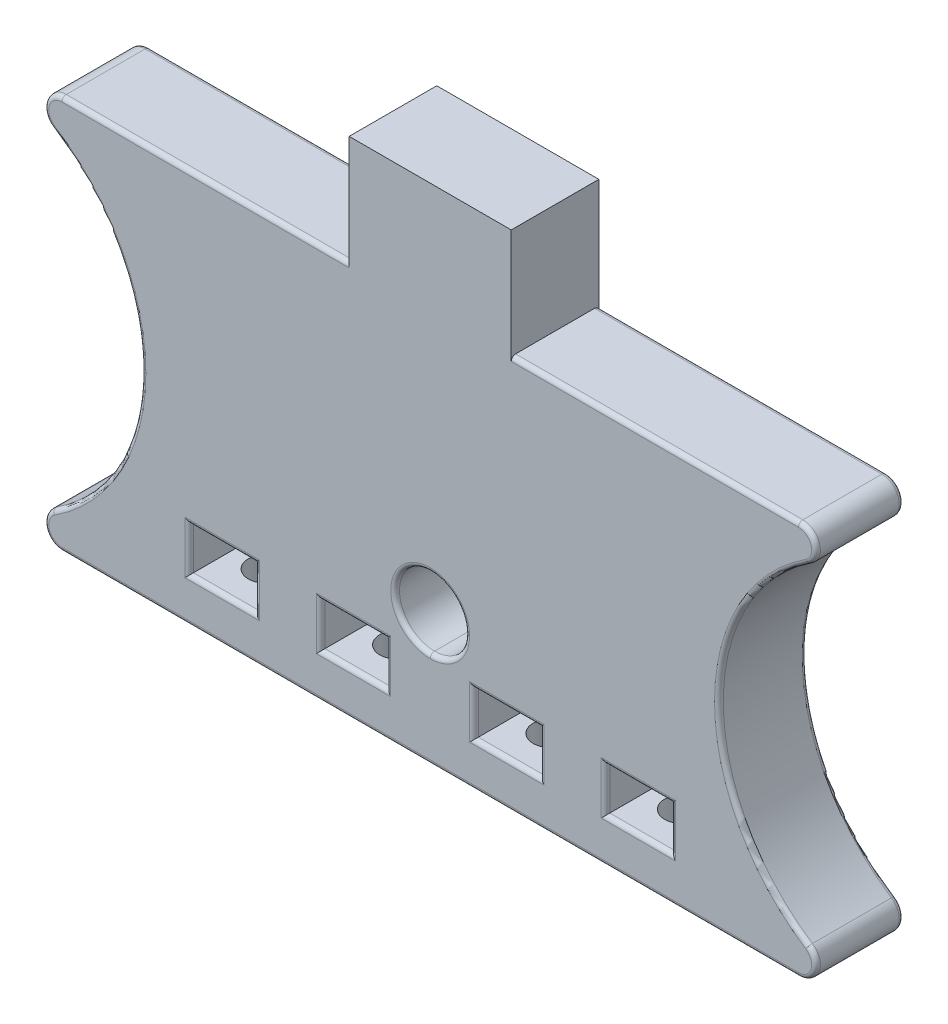
from build123d import *

# Parameters (mm, degrees)
BOSS_EXTRUDE1_DEPTH = 10
FILLET1_START       = -1
FILLET1_DEPTH       = 12
SKETCH2_W           = 7.5
SKETCH2_H           = 5
CUT_EXTRUDE1_DEPTH  = 8.75
SKETCH3_R           = 2
CUT_EXTRUDE2_DEPTH  = 8.75
FILLET2_R           = 0.5
BOSS_EXTRUDE2_START = -10
SKETCH5_W           = 18.495590606
SKETCH5_H           = 25
BOSS_EXTRUDE2_DEPTH = 10


with BuildPart() as part:
    # Sketch1 → Boss-Extrude1 (new body)
    with BuildSketch(Plane.XY):
        with BuildLine():
            Line((0, -15), (55.445040355, -15))
            ThreePointArc((55.445040355, -15), (32.945040355, 7.5), (55.445040355, 30))
            Line((55.445040355, 30), (-55.445040355, 30))
            ThreePointArc((-55.445040355, 30), (-39.535137779, 23.409902577), (-32.945040355, 7.5))
            ThreePointArc((-32.945040355, 7.5), (-39.535137779, -8.409902577), (-55.445040355, -15))
            Line((-55.445040355, -15), (0, -15))
        make_face()
        with BuildLine():
            ThreePointArc((4, 0), (2.828427125, -2.828427125), (0, -4))
            ThreePointArc((0, -4), (-4, 0), (0, 4))
            ThreePointArc((0, 4), (2.828427125, 2.828427125), (4, 0))
        make_face(mode=Mode.SUBTRACT)
    extrude(amount=BOSS_EXTRUDE1_DEPTH)

    # Fillet1: read off the stored shape, not the designer's step
    # Fillet1 outline → Fillet1 (cut)
    with BuildSketch(Plane.XY.offset(FILLET1_START)):
        with BuildLine():
            Line((55.445040355, 30), (42.02863249, 30))
            ThreePointArc((42.02863249, 30), (43.945262185, 28.571428571), (43.123849459, 26.326530612))
            ThreePointArc((43.123849459, 26.326530612), (49.016468927, 29.062084069), (55.445040355, 30))
        make_face()
        with BuildLine():
            ThreePointArc((-43.123849459, 26.326530612), (-43.945262185, 28.571428571), (-42.02863249, 30))
            Line((-42.02863249, 30), (-55.445040355, 30))
            ThreePointArc((-55.445040355, 30), (-49.016468927, 29.062084069), (-43.123849459, 26.326530612))
        make_face()
        with BuildLine():
            ThreePointArc((55.445040355, -15), (49.016468927, -14.062084069), (43.123849459, -11.326530612))
            ThreePointArc((43.123849459, -11.326530612), (43.945262185, -13.571428571), (42.02863249, -15))
            Line((42.02863249, -15), (55.445040355, -15))
        make_face()
        with BuildLine():
            ThreePointArc((-42.02863249, -15), (-43.945262185, -13.571428571), (-43.123849459, -11.326530612))
            ThreePointArc((-43.123849459, -11.326530612), (-49.016468927, -14.062084069), (-55.445040355, -15))
            Line((-55.445040355, -15), (-42.02863249, -15))
        make_face()
    extrude(amount=FILLET1_DEPTH, mode=Mode.SUBTRACT)

    # Sketch2 → Cut-Extrude1 (cut)
    with BuildSketch(Plane.XY.offset(10)):
        with Locations((-23.75, -7.5)):
            Rectangle(SKETCH2_W, SKETCH2_H)
        with Locations((-8.75, -7.5)):
            Rectangle(SKETCH2_W, SKETCH2_H)
        with Locations((8.75, -7.5)):
            Rectangle(SKETCH2_W, SKETCH2_H)
        with Locations((23.75, -7.5)):
            Rectangle(SKETCH2_W, SKETCH2_H)
    extrude(amount=-CUT_EXTRUDE1_DEPTH, mode=Mode.SUBTRACT)

    # Sketch3 → Cut-Extrude2 (cut)
    with BuildSketch(Plane.XZ.offset(15)):
        with Locations(Location((-23.75, 5, 0), (0, 0, 270))):
            Circle(SKETCH3_R)
        with Locations(Location((-8.75, 5, 0), (0, 0, 270))):
            Circle(SKETCH3_R)
        with Locations(Location((8.75, 5, 0), (0, 0, 270))):
            Circle(SKETCH3_R)
        with Locations(Location((23.75, 5, 0), (0, 0, 270))):
            Circle(SKETCH3_R)
    extrude(amount=-CUT_EXTRUDE2_DEPTH, mode=Mode.SUBTRACT)

    # Fillet2
    fillet2_edges = [part.edges().sort_by_distance(p)[0] for p in [
        (0, 4, 0),
        (0, 4, 0),
        (0, 4, 10),
        (0, 30, 0),
        (0, 30, 10),
        (-32.945040355, 7.5, 0),
        (32.945040355, 7.5, 0),
        (0, -15, 0),
        (-43.945262185, -13.571428571, 0),
        (-43.945262185, 28.571428571, 0),
        (43.945262185, -13.571428571, 0),
        (43.945262185, 28.571428571, 0),
        (32.945040355, 7.5, 10),
        (-32.945040355, 7.5, 10),
        (0, -15, 10),
        (-43.945262185, -13.571428571, 10),
        (-43.945262185, 28.571428571, 10),
        (43.945262185, -13.571428571, 10),
        (43.945262185, 28.571428571, 10),
        (0, 4, 10),
        (-20, -7.5, 10),
        (-23.75, -5, 10),
        (-27.5, -7.5, 10),
        (-23.75, -10, 10),
        (-5, -7.5, 10),
        (-8.75, -5, 10),
        (-12.5, -7.5, 10),
        (-8.75, -10, 10),
        (12.5, -7.5, 10),
        (8.75, -5, 10),
        (5, -7.5, 10),
        (8.75, -10, 10),
        (27.5, -7.5, 10),
        (23.75, -5, 10),
        (20, -7.5, 10),
        (23.75, -10, 10),
    ]]
    fillet(fillet2_edges, radius=FILLET2_R)

    # Sketch5 → Boss-Extrude2 (add)
    with BuildSketch(Plane(origin=(0, 0, 0), x_dir=(-1, 0, 0), z_dir=(0, 0, -1)).offset(BOSS_EXTRUDE2_START)):
        with Locations((0, 30)):
            Rectangle(SKETCH5_W, SKETCH5_H)
    extrude(amount=BOSS_EXTRUDE2_DEPTH)


solid = part.part
